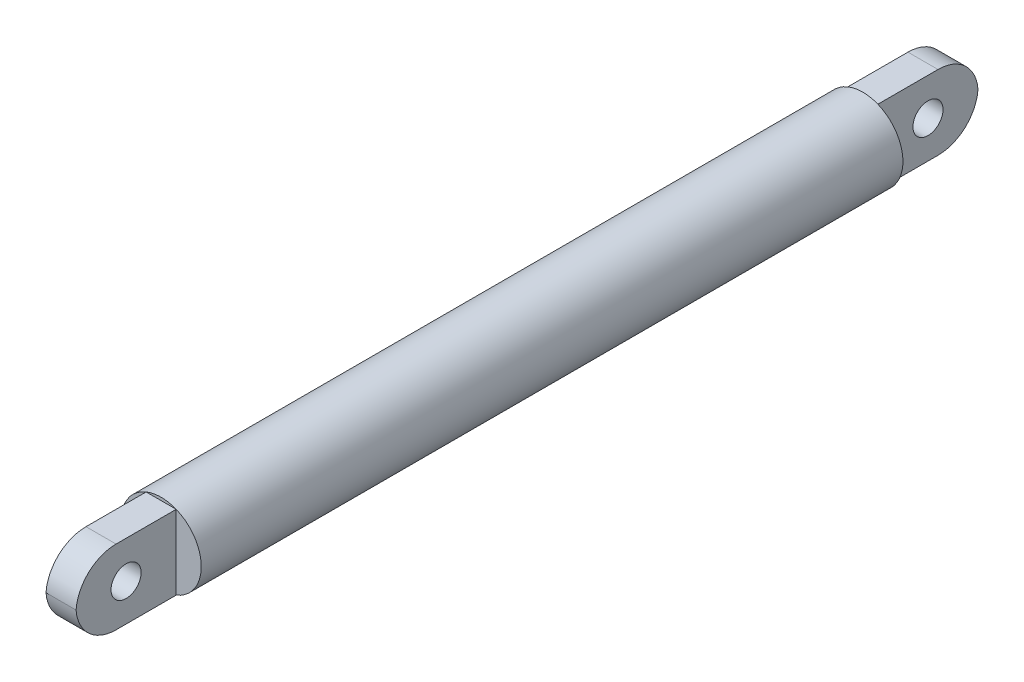
from build123d import *

# Parameters (mm, degrees)
CROQUIS2_R              = 4
SALIENTE_EXTRUIR1_DEPTH = 70
CROQUIS3_W              = 3
CROQUIS3_H              = 7.416198488
SALIENTE_EXTRUIR2_DEPTH = 10
CROQUIS4_W              = 3
CROQUIS4_H              = 7.416198488
SALIENTE_EXTRUIR3_DEPTH = 10
CROQUIS5_R              = 1.5
CORTAR_EXTRUIR1_DEPTH   = 81.288542146
REDONDEO1_R             = 4


with BuildPart() as part:
    # Croquis2 → Saliente-Extruir1 (new body)
    with BuildSketch(Plane.XY):
        Circle(CROQUIS2_R)
    extrude(amount=SALIENTE_EXTRUIR1_DEPTH)

    # Croquis3 → Saliente-Extruir2 (add)
    with BuildSketch(Plane.XY.offset(70)):
        Rectangle(CROQUIS3_W, CROQUIS3_H)
    extrude(amount=SALIENTE_EXTRUIR2_DEPTH)

    # Croquis4 → Saliente-Extruir3 (add)
    with BuildSketch(Plane(origin=(0, 0, 0), x_dir=(-1, 0, 0), z_dir=(0, 0, -1))):
        Rectangle(CROQUIS4_W, CROQUIS4_H)
    extrude(amount=SALIENTE_EXTRUIR3_DEPTH)

    # Croquis5 → Cortar-Extruir1 (cut, through all)
    with BuildSketch(Plane(origin=(1.5, 0, 0), x_dir=(0, 0, -1), z_dir=(1, 0, 0))):
        with Locations((-75, 0)):
            Circle(CROQUIS5_R)
        with Locations((5, 0)):
            Circle(CROQUIS5_R)
    extrude(amount=-CORTAR_EXTRUIR1_DEPTH, mode=Mode.SUBTRACT)

    # Redondeo1
    # the kernel refuses this fillet: 4 mm, written as the material it takes off along each edge
    with BuildSketch(Plane(origin=(-11.5, -3.708099244, -10), x_dir=(0, 0, 1), z_dir=(1, 0, 0)), Plane(origin=(11.5, 3.708099244, -10), x_dir=(0, 0, 1), z_dir=(-1, 0, 0))) as redondeo1_piece_1:
        with BuildLine():
            CenterArc((REDONDEO1_R, -REDONDEO1_R), REDONDEO1_R, 90, 90)
            Line((0, -REDONDEO1_R), (0, 0))
            Line((0, 0), (REDONDEO1_R, 0))
        make_face()
    extrude(amount=23, mode=Mode.SUBTRACT)
    with BuildSketch(Plane(origin=(-11.5, -3.708099244, 80), x_dir=(0, 0, -1), z_dir=(1, 0, 0)), Plane(origin=(11.5, 3.708099244, 80), x_dir=(0, 0, -1), z_dir=(-1, 0, 0))) as redondeo1_piece_2:
        with BuildLine():
            CenterArc((REDONDEO1_R, REDONDEO1_R), REDONDEO1_R, 180, 90)
            Line((0, REDONDEO1_R), (0, 0))
            Line((0, 0), (REDONDEO1_R, 0))
        make_face()
    extrude(amount=23, mode=Mode.SUBTRACT)


solid = part.part
